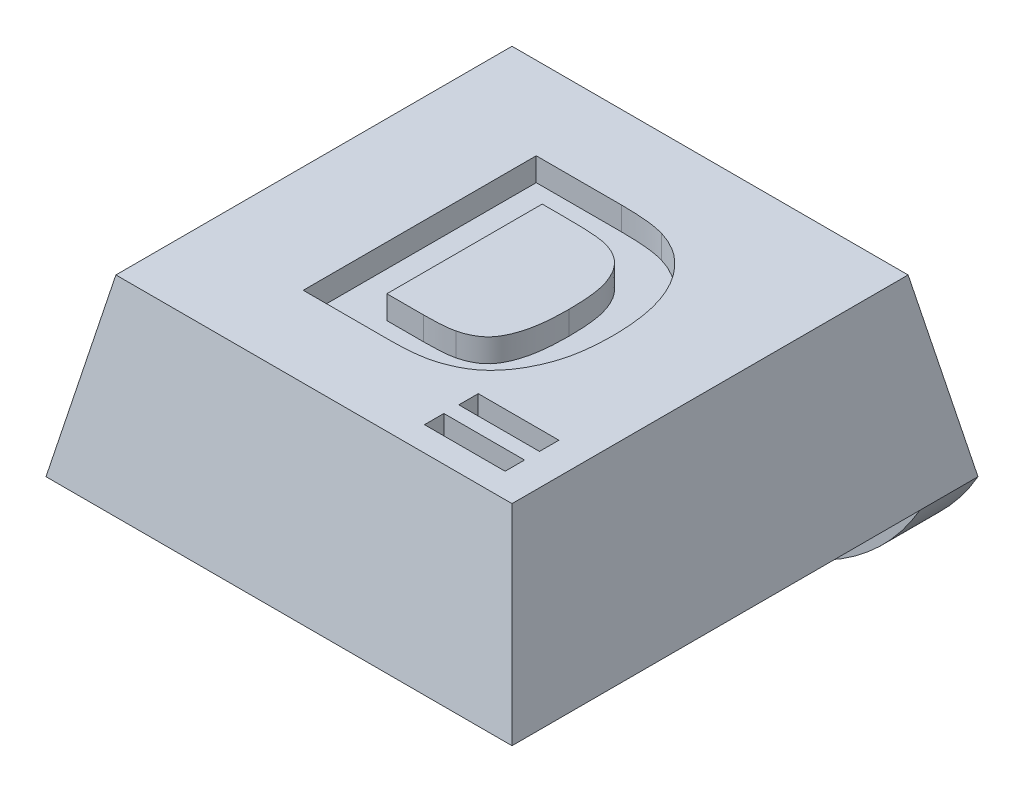
from build123d import *

# Parameters (mm, degrees)
SKETCH1_W               = 8
SKETCH1_H               = 8
BOSS_EXTRUDE1_DEPTH     = 3
CUT_EXTRUDE1_DEPTH      = 12.704699911
CUT_EXTRUDE1_DEPTH_BACK = 12.704699911
CUT_EXTRUDE2_DEPTH      = 11
SKETCH4_R               = 1.8
CUT_EXTRUDE3_DEPTH      = 0.8
SKETCH5_W               = 8
SKETCH5_H               = 1
BOSS_EXTRUDE2_DEPTH     = 2
FILLET1_R               = 4
CUT_EXTRUDE4_DEPTH      = 0.4
SKETCH7_W               = 1.384615385
SKETCH7_H               = 0.333333334
CUT_EXTRUDE5_DEPTH      = 0.4


with BuildPart() as part:
    # Sketch1 → Boss-Extrude1 (new body)
    with BuildSketch(Plane(origin=(0, 0, 0), x_dir=(1, 0, 0), z_dir=(0, 1, 0))):
        with Locations((4, 4)):
            Rectangle(SKETCH1_W, SKETCH1_H)
    extrude(amount=BOSS_EXTRUDE1_DEPTH)

    # Sketch2 → Cut-Extrude1 (cut, two sides: drawn at the far end of the back side and taken through both)
    with BuildSketch(Plane.XY.offset(-CUT_EXTRUDE1_DEPTH_BACK)):
        Polygon((0, 0), (0.6, 3), (0, 3), align=None)
        Polygon((8, 0), (7.4, 3), (8, 3), align=None)
    extrude(amount=CUT_EXTRUDE1_DEPTH + CUT_EXTRUDE1_DEPTH_BACK, mode=Mode.SUBTRACT)

    # Sketch3 → Cut-Extrude2 (cut)
    with BuildSketch(Plane(origin=(0, 0, 0), x_dir=(0, 0, -1), z_dir=(1, 0, 0))):
        Polygon((0, 0), (0.6, 3), (0, 3), align=None)
        Polygon((8, 3), (7.4, 3), (8, 0), align=None)
    extrude(amount=CUT_EXTRUDE2_DEPTH, mode=Mode.SUBTRACT)

    # Sketch4 → Cut-Extrude3 (cut)
    with BuildSketch(Plane.XZ):
        with Locations(Location((4, -3.75, 0), (0, 0, 270))):
            Circle(SKETCH4_R)
    extrude(amount=-CUT_EXTRUDE3_DEPTH, mode=Mode.SUBTRACT)

    # Sketch5 → Boss-Extrude2 (add)
    with BuildSketch(Plane.XZ):
        with Locations((4, -7.5)):
            Rectangle(SKETCH5_W, SKETCH5_H)
    extrude(amount=BOSS_EXTRUDE2_DEPTH)

    # Fillet1
    # the kernel refuses this fillet: 4 mm, written as the material it takes off along each edge
    with BuildSketch(Plane(origin=(8, -2, -16.660254038), x_dir=(0, 1, 0), z_dir=(0, 0, 1)), Plane(origin=(0, -2, 1.660254038), x_dir=(0, 1, 0), z_dir=(0, 0, -1))) as fillet1_piece_1:
        with BuildLine():
            CenterArc((4, 3.464101615), FILLET1_R, 180, 60)
            Line((0, 3.464101615), (-0.08, 3.464101615))
            Line((-0.08, 3.464101615), (-0.08, 0))
            Line((-0.08, 0), (0, -0.08))
            ThreePointArc((0, -0.08), (1, -0.08), (1.96, -0.069282032))
            Line((1.96, -0.069282032), (2, 0))
        make_face()
    extrude(amount=18.320508076, mode=Mode.SUBTRACT)

    # Sketch6 → Cut-Extrude4 (cut)
    with BuildSketch(Plane(origin=(0, 3, 0), x_dir=(1, 0, 0), z_dir=(0, 1, 0))):
        with BuildLine():
            Line((2.436272881, 5.979723732), (3.903420317, 5.979723732))
            add(Edge.make_bspline(
                [(3.903420317, 5.979723732), (3.943490496, 5.979744505), (4.021516441, 5.979784954), (4.134752515, 5.975087302), (4.240642802, 5.970362082), (4.338883372, 5.960903224), (4.429815049, 5.950988663), (4.51360101, 5.938436084), (4.589711972, 5.922348579), (4.637707501, 5.909661658), (4.660631856, 5.903601937)],
                knots=[0, 0, 0, 0, 1.259756885, 2.453039283, 3.563158368, 4.591894114, 5.55549294, 6.43918076, 7.254497783, 8, 8, 8, 8], degree=3))
            add(Edge.make_bspline(
                [(4.660631856, 5.903601937), (4.689300162, 5.894258489), (4.74612039, 5.87573989), (4.829420592, 5.843292221), (4.908343197, 5.803050568), (4.985816138, 5.760749105), (5.058380803, 5.710732544), (5.129877456, 5.658697008), (5.195666079, 5.598419283), (5.281939397, 5.514177193), (5.380383811, 5.396825298), (5.483519335, 5.241163905), (5.570813292, 5.070304112), (5.630456537, 4.917219685), (5.670729972, 4.787084992), (5.697056277, 4.682749965), (5.719418871, 4.572846322), (5.737778631, 4.457346355), (5.752043635, 4.336250048), (5.762664083, 4.209589679), (5.767837312, 4.07725583), (5.769008616, 3.987205692), (5.769606215, 3.941262194)],
                knots=[0, 0, 0, 0, 0.745524535, 1.477620414, 2.207090574, 2.934465325, 3.657932502, 4.384347339, 5.118673636, 5.861150177, 7.365375624, 8.894729774, 10.468936425, 12.099947606, 12.950091786, 13.83580991, 14.759228729, 15.722225242, 16.726454549, 17.773376212, 18.863978586, 20, 20, 20, 20], degree=3))
            add(Edge.make_bspline(
                [(5.769606215, 3.941262194), (5.768515323, 3.861857727), (5.766405561, 3.708291084), (5.741963835, 3.486695058), (5.70674022, 3.280872561), (5.667035899, 3.152471539), (5.647811343, 3.090300655)],
                knots=[0, 0, 0, 0, 1.103207939, 2.133582005, 3.096293362, 4, 4, 4, 4], degree=3))
            add(Edge.make_bspline(
                [(5.647811343, 3.090300655), (5.635116766, 3.054625647), (5.610144552, 2.98444734), (5.566445051, 2.883214788), (5.519227431, 2.786877042), (5.468100041, 2.695510004), (5.412804571, 2.609524646), (5.353134197, 2.529178156), (5.290013855, 2.453412746), (5.244286819, 2.406778778), (5.221529292, 2.383569886)],
                knots=[0, 0, 0, 0, 1.090884612, 2.145940218, 3.175104604, 4.181306866, 5.161203701, 6.118658341, 7.063689906, 8, 8, 8, 8], degree=3))
            add(Edge.make_bspline(
                [(5.221529292, 2.383569886), (5.184702113, 2.350450915), (5.108759222, 2.282154876), (4.974934842, 2.197635799), (4.823675662, 2.122952418), (4.714264019, 2.084588805), (4.657426727, 2.06465963)],
                knots=[0, 0, 0, 0, 0.908140292, 1.872714733, 2.8949153, 4, 4, 4, 4], degree=3))
            add(Edge.make_bspline(
                [(4.657426727, 2.06465963), (4.634546833, 2.057632533), (4.587060796, 2.043048157), (4.511767003, 2.027471741), (4.431388989, 2.011061834), (4.344999886, 2.001176252), (4.253496453, 1.990751469), (4.156149493, 1.984898536), (4.053296456, 1.980743294), (3.98275208, 1.980068625), (3.946689548, 1.979723732)],
                knots=[0, 0, 0, 0, 0.799129865, 1.658552685, 2.566799617, 3.538529252, 4.561352959, 5.643373779, 6.795284424, 8, 8, 8, 8], degree=3))
            Line((3.946689548, 1.979723732), (2.436272881, 1.979723732))
            Line((2.436272881, 1.979723732), (2.436272881, 5.979723732))
        make_face()
        with BuildLine():
            Line((3.205503651, 5.313057065), (3.205503651, 2.646390399))
            Line((3.205503651, 2.646390399), (3.838516471, 2.646390399))
            add(Edge.make_bspline(
                [(3.838516471, 2.646390399), (3.86709534, 2.646617049), (3.922120581, 2.647053436), (4.001743514, 2.648335709), (4.07491632, 2.651807064), (4.142022322, 2.655402822), (4.202886818, 2.661343643), (4.257774639, 2.667186667), (4.306380252, 2.675360935), (4.336400272, 2.681813595), (4.350535702, 2.684851937)],
                knots=[0, 0, 0, 0, 1.333384787, 2.567275092, 3.714769766, 4.750907381, 5.701951617, 6.567520054, 7.325492842, 8, 8, 8, 8], degree=3))
            add(Edge.make_bspline(
                [(4.350535702, 2.684851937), (4.38364248, 2.693686468), (4.44812575, 2.710893803), (4.538666782, 2.749253907), (4.62059475, 2.795531175), (4.695281698, 2.8511776), (4.762590099, 2.92150181), (4.820046047, 3.011440962), (4.873220012, 3.118706088), (4.909633556, 3.221385639), (4.935771128, 3.313096613), (4.95346412, 3.390071897), (4.967446413, 3.47335137), (4.979473009, 3.562606359), (4.989190784, 3.657722085), (4.995237644, 3.759042029), (4.999364663, 3.866442163), (5.000032135, 3.940189623), (5.000375445, 3.978121168)],
                knots=[0, 0, 0, 0, 1.038686998, 2.023088296, 2.974059649, 3.888265163, 4.839857954, 5.909819677, 7.113156087, 8.466843969, 9.20827164, 10.006482943, 10.861893492, 11.769681931, 12.739021491, 13.762258324, 14.849031541, 16, 16, 16, 16], degree=3))
            add(Edge.make_bspline(
                [(5.000375445, 3.978121168), (5.000034775, 4.01605283), (4.999374834, 4.089533605), (4.995254144, 4.196132914), (4.989241251, 4.29585735), (4.979454269, 4.38883019), (4.967614104, 4.475179926), (4.953468032, 4.554979633), (4.935881696, 4.627705609), (4.909721893, 4.71410541), (4.870064977, 4.811221472), (4.816099655, 4.917402921), (4.749828382, 5.00790436), (4.676605078, 5.08652444), (4.592177372, 5.151224792), (4.498716105, 5.205415106), (4.394186359, 5.247475499), (4.319831067, 5.2653904), (4.281625445, 5.274595527)],
                knots=[0, 0, 0, 0, 1.117996097, 2.165769068, 3.143980016, 4.062055362, 4.920439205, 5.712587309, 6.449616741, 7.124491204, 8.371470382, 9.537068822, 10.625202851, 11.666538334, 12.693249444, 13.747832046, 14.842779399, 16, 16, 16, 16], degree=3))
            add(Edge.make_bspline(
                [(4.281625445, 5.274595527), (4.265088191, 5.27766838), (4.228679487, 5.284433627), (4.168262747, 5.292335475), (4.097380449, 5.298199321), (4.015671249, 5.304185793), (3.923465993, 5.307602683), (3.820378875, 5.311168762), (3.706841263, 5.312386928), (3.627511913, 5.312827267), (3.586112625, 5.313057065)],
                knots=[0, 0, 0, 0, 0.578738571, 1.274160813, 2.095454135, 3.025967819, 4.093109015, 5.270126069, 6.575371698, 8, 8, 8, 8], degree=3))
            Line((3.586112625, 5.313057065), (3.205503651, 5.313057065))
        make_face(mode=Mode.SUBTRACT)
    extrude(amount=-CUT_EXTRUDE4_DEPTH, mode=Mode.SUBTRACT)

    # Sketch7 → Cut-Extrude5 (cut)
    with BuildSketch(Plane(origin=(0, 3, 0), x_dir=(1, 0, 0), z_dir=(0, 1, 0))):
        with Locations((6.167407218, 1.778686134)):
            Rectangle(SKETCH7_W, SKETCH7_H)
        with Locations((6.167407218, 1.188942544)):
            Rectangle(SKETCH7_W, SKETCH7_H)
    extrude(amount=-CUT_EXTRUDE5_DEPTH, mode=Mode.SUBTRACT)


solid = part.part
